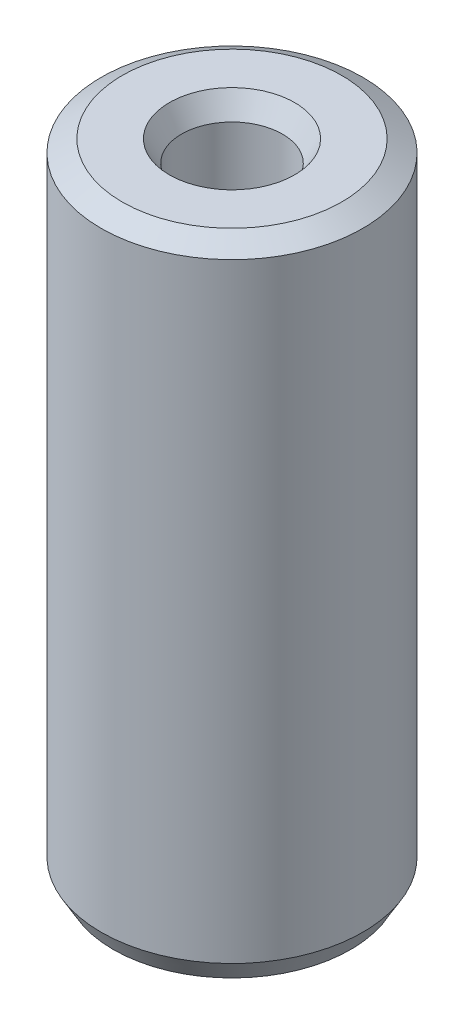
from build123d import *
from OCP.BRepFilletAPI import BRepFilletAPI_MakeChamfer

# Parameters (mm, degrees)
SKETCH1_R           = 32.5
BOSS_EXTRUDE1_DEPTH = 159.6660584
SKETCH2_R           = 12.526483191
CUT_EXTRUDE1_DEPTH  = 167.14978244
CHAMFER1_SIZE       = 3.034279474
CHAMFER1_SIZE2      = 5.255526213


with BuildPart() as part:
    # Sketch1 → Boss-Extrude1 (new body)
    with BuildSketch(Plane(origin=(0, 0, 0), x_dir=(1, 0, 0), z_dir=(0, 1, 0))):
        Circle(SKETCH1_R)
    extrude(amount=BOSS_EXTRUDE1_DEPTH)

    # Sketch2 → Cut-Extrude1 (cut, through all)
    with BuildSketch(Plane(origin=(0, 0, 0), x_dir=(1, 0, 0), z_dir=(0, 1, 0))):
        Circle(SKETCH2_R)
    extrude(amount=CUT_EXTRUDE1_DEPTH, mode=Mode.SUBTRACT)

    # Chamfer1: one chamfer whose edges measure the first distance from different faces: ONE call of the kernel's chamfer builder (chamfer() names one face for all edges)
    chamfer1_edges_1 = [part.edges().sort_by_distance(p)[0] for p in [
        (-12.526483191, 159.6660584, 0),
    ]]
    chamfer1_side_1 = [part.faces().sort_by_distance(p)[0] for p in [
        (-31.580761184, 159.6660584, 0),
    ]]
    chamfer1_edges_2 = [part.edges().sort_by_distance(p)[0] for p in [
        (-12.526483191, 0, 0),
    ]]
    chamfer1_side_2 = [part.faces().sort_by_distance(p)[0] for p in [
        (-12.526483191, 79.8330292, 0),
    ]]
    chamfer1_edges_3 = [part.edges().sort_by_distance(p)[0] for p in [
        (-32.5, 0, 0),
    ]]
    chamfer1_side_3 = [part.faces().sort_by_distance(p)[0] for p in [
        (-31.580761184, 0, 0),
    ]]
    chamfer1_edges_4 = [part.edges().sort_by_distance(p)[0] for p in [
        (-32.5, 159.6660584, 0),
    ]]
    chamfer1_side_4 = [part.faces().sort_by_distance(p)[0] for p in [
        (-32.5, 79.8330292, 0),
    ]]
    chamfer1 = BRepFilletAPI_MakeChamfer(part.part.solid().wrapped)
    for e in chamfer1_edges_1:
        chamfer1.Add(CHAMFER1_SIZE, CHAMFER1_SIZE2, e.wrapped, chamfer1_side_1[0].wrapped)  # the first distance lies on this face
    for e in chamfer1_edges_2:
        chamfer1.Add(CHAMFER1_SIZE, CHAMFER1_SIZE2, e.wrapped, chamfer1_side_2[0].wrapped)  # the first distance lies on this face
    for e in chamfer1_edges_3:
        chamfer1.Add(CHAMFER1_SIZE, CHAMFER1_SIZE2, e.wrapped, chamfer1_side_3[0].wrapped)  # the first distance lies on this face
    for e in chamfer1_edges_4:
        chamfer1.Add(CHAMFER1_SIZE, CHAMFER1_SIZE2, e.wrapped, chamfer1_side_4[0].wrapped)  # the first distance lies on this face
    add(Compound.cast(chamfer1.Shape()), mode=Mode.REPLACE)


solid = part.part
